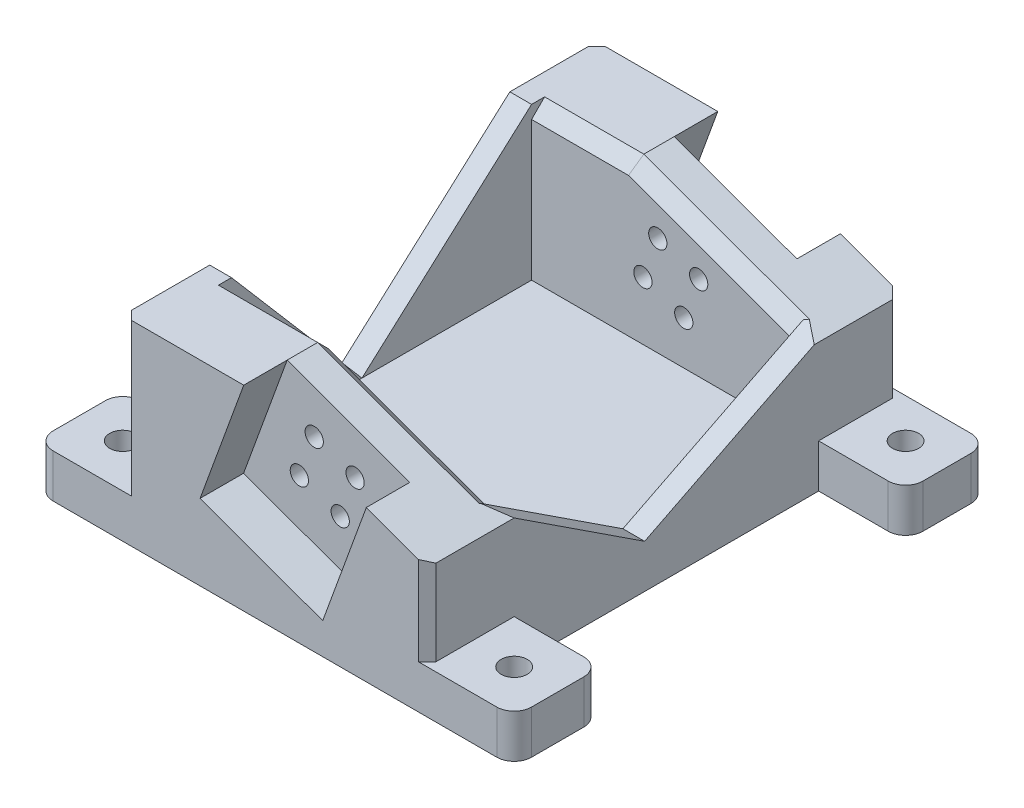
from build123d import *

# Parameters (mm, degrees)
EXTRUDE_1_DEPTH          = 35
EXTRUDE_1_2_DEPTH        = 35
CUT_EXTRUDE_1_DEPTH      = 104.662915259
CUT_EXTRUDE_1_DEPTH_BACK = 104.662915259
SKETCH_2_R               = 2.1
SKETCH_3_W               = 70
SKETCH_3_H               = 10
EXTRUDE_2_DEPTH          = 89
EXTRUDE_3_DEPTH          = 10
EXTRUDE_4_DEPTH          = 10
SKETCH_8_W               = 20
SKETCH_8_H               = 19
SKETCH_8_R               = 3
SKETCH_8_H_2             = 20
EXTRUDE_9_DEPTH          = 10
EXTRUDE_10_DEPTH         = 5
CUT_EXTRUDE_2_DEPTH      = 130.251692445
CUT_EXTRUDE_2_DEPTH_BACK = 130.251692445
EXTRUDE_12_DEPTH         = 5
FILLET_1_R               = 4
FILLET_2_R               = 4
CHAMFER_3_SIZE           = 3
CHAMFER_4_SIZE           = 2


with BuildPart() as part:
    # Эскиз1 → Бобышка-Вытянуть1 (new body)
    with BuildSketch(Plane(origin=(0, 0, 0), x_dir=(1, 0, 0), z_dir=(0, 1, 0))):
        Polygon((0, -40), (30, -40), (30, -30), (-40, -30), (-40, -40), align=None)
    extrude(amount=EXTRUDE_1_DEPTH)


with BuildPart() as body_2:
    # Эскиз1 → Extrude 1 2 (new body)
    with BuildSketch(Plane(origin=(0, 0, 0), x_dir=(1, 0, 0), z_dir=(0, 1, 0))):
        Polygon((0, 49), (30, 49), (30, 39), (-40, 39), (-40, 49), align=None)
    extrude(amount=EXTRUDE_1_2_DEPTH)


with BuildPart() as cut_extrude_1_tool:
    # Эскиз2 → Вырез-Вытянуть1 (new, two sides: drawn at the far end of the back side and taken through both)
    with BuildSketch(Plane.XY.offset(40).offset(-CUT_EXTRUDE_1_DEPTH_BACK)):
        with Locations((0, 10)):
            Circle(SKETCH_2_R)
        with Locations((-9.396926208, 13.420201433)):
            Circle(SKETCH_2_R)
        with Locations((3.420201433, 19.396926208)):
            Circle(SKETCH_2_R)
        with Locations((-5.976724775, 22.817127641)):
            Circle(SKETCH_2_R)
    extrude(amount=CUT_EXTRUDE_1_DEPTH + CUT_EXTRUDE_1_DEPTH_BACK)


with BuildPart() as part_1:
    add(part.part)

    # Вырез-Вытянуть1: cut by cut_extrude_1_tool
    add(cut_extrude_1_tool.part, mode=Mode.SUBTRACT)



with BuildPart() as body_2_1:
    add(body_2.part)

    # Вырез-Вытянуть1: cut by cut_extrude_1_tool
    add(cut_extrude_1_tool.part, mode=Mode.SUBTRACT)


with BuildPart() as part_2:
    add(part_1.part)

    add(body_2_1.part)  # Бобышка-Вытянуть2 merges body 2
    # Эскиз3 → Бобышка-Вытянуть2 (add)
    with BuildSketch(Plane.XY.offset(40)):
        with Locations((-5, -5)):
            Rectangle(SKETCH_3_W, SKETCH_3_H)
    extrude(amount=-EXTRUDE_2_DEPTH)

    # Эскиз4 → Бобышка-Вытянуть3 (add)
    with BuildSketch(Plane.XY.offset(40)):
        Polygon((5.976724775, -2.817127641), (-22.214053849, 7.443476659), (-12.184299593, 35), (-40, 35), (-40, -10), (30, -10), (30, 35), (19.741033581, 35), align=None)
    extrude(amount=EXTRUDE_3_DEPTH)

    # Эскиз5 → Бобышка-Вытянуть4 (add)
    with BuildSketch(Plane(origin=(0, 0, -49), x_dir=(-1, 0, 0), z_dir=(0, 0, -1))):
        Polygon((-30, 35), (-30, -10), (40, -10), (40, 35), (12.184299593, 35), (22.214053849, 7.443476659), (-5.976724775, -2.817127641), (-19.741033581, 35), align=None)
    extrude(amount=EXTRUDE_4_DEPTH)

    # Эскиз8 → Бобышка-Вытянуть9 (add)
    # profile 1 of 4: a face of its own
    with BuildSketch(Plane(origin=(0, -10, 0), x_dir=(-1, 0, 0), z_dir=(0, -1, 0))):
        with Locations((-40, 49.5)):
            Rectangle(SKETCH_8_W, SKETCH_8_H)
        with Locations(Location((-40, 50, 0), (0, 0, 90))):
            Circle(SKETCH_8_R, mode=Mode.SUBTRACT)
    # profile 2 of 4: a face of its own
    with BuildSketch(Plane(origin=(0, -10, 0), x_dir=(-1, 0, 0), z_dir=(0, -1, 0))):
        with Locations((-40, -40)):
            Rectangle(SKETCH_8_W, SKETCH_8_H_2)
        with Locations(Location((-40, -40, 0), (0, 0, 90))):
            Circle(SKETCH_8_R, mode=Mode.SUBTRACT)
    # profile 3 of 4: a face of its own
    with BuildSketch(Plane(origin=(0, -10, 0), x_dir=(-1, 0, 0), z_dir=(0, -1, 0))):
        with Locations((50, 49.5)):
            Rectangle(SKETCH_8_W, SKETCH_8_H)
        with Locations(Location((50, 50, 0), (0, 0, 90))):
            Circle(SKETCH_8_R, mode=Mode.SUBTRACT)
    # profile 4 of 4: a face of its own
    with BuildSketch(Plane(origin=(0, -10, 0), x_dir=(-1, 0, 0), z_dir=(0, -1, 0))):
        with Locations((50, -40)):
            Rectangle(SKETCH_8_W, SKETCH_8_H_2)
        with Locations(Location((50, -40, 0), (0, 0, 90))):
            Circle(SKETCH_8_R, mode=Mode.SUBTRACT)
    extrude(amount=-EXTRUDE_9_DEPTH)

    # Эскиз6 → Бобышка-Вытянуть10 (add)
    with BuildSketch(Plane.ZY.offset(40)):
        Polygon((-39, 0), (0, 0), (-39, 35), align=None)
        Polygon((30, 0), (30, 35), (0, 0), align=None)
    extrude(amount=-EXTRUDE_10_DEPTH)

    # Эскиз10 → Вырез-Вытянуть2 (cut, two sides: drawn at the far end of the back side and taken through both)
    with BuildSketch(Plane.XY.offset(50).offset(-CUT_EXTRUDE_2_DEPTH_BACK)):
        Polygon((30, 19.646170595), (-12.184299593, 35), (30, 35), align=None)
    extrude(amount=CUT_EXTRUDE_2_DEPTH + CUT_EXTRUDE_2_DEPTH_BACK, mode=Mode.SUBTRACT)

    # Эскиз9 → Бобышка-Вытянуть12 (add)
    with BuildSketch(Plane(origin=(30, 0, 0), x_dir=(0, 0, -1), z_dir=(1, 0, 0))):
        Polygon((39, 19.646170595), (39, 0), (0, 0), align=None)
        Polygon((0, 0), (-30, 19.646170595), (-30, 0), align=None)
    extrude(amount=-EXTRUDE_12_DEPTH)

    # Скругление1
    fillet_1_edges = [part_2.edges().sort_by_distance(p)[0] for p in [
        (50, -5, -59),
        (50, -5, 50),
        (-60, -5, -59),
        (-60, -5, 50),
    ]]
    fillet(fillet_1_edges, radius=FILLET_1_R)

    # Скругление2
    fillet_2_edges = [part_2.edges().sort_by_distance(p)[0] for p in [
        (50, -5, -40),
        (50, -5, 30),
        (-60, -5, -40),
        (-60, -5, 30),
    ]]
    fillet(fillet_2_edges, radius=FILLET_2_R)

    # Фаска3
    # the kernel refuses this chamfer: 3 mm, written as the material it takes off along each edge
    with BuildSketch(Plane(origin=(-4.469250629, 35, -39), x_dir=(0, 0.027495876610586768, -0.9996219169112968), z_dir=(-1, 0, 0))) as chamfer_3_piece_1:
        Polygon((CHAMFER_3_SIZE * 0.999621916911, CHAMFER_3_SIZE * 0.0274958766106), (-CHAMFER_3_SIZE * 0.0274958766106, CHAMFER_3_SIZE * 0.999621916911), (0, 0), align=None)
    extrude(amount=30.530749371, mode=Mode.SUBTRACT)
    with BuildSketch(Plane(origin=(-19.434074173, 37.638702152, -39), x_dir=(0.009404143659217951, 0.02583767235300856, -0.9996219169112968), z_dir=(0.9396926207859079, -0.34202014332567027, 0))) as chamfer_3_piece_2_section:
        Polygon((CHAMFER_3_SIZE * 0.999621916911, -CHAMFER_3_SIZE * 0.0274958766106), (-CHAMFER_3_SIZE * 0.0274958766106, -CHAMFER_3_SIZE * 0.999621916911), (0, 0), align=None)
    chamfer_3_piece_2 = extrude(amount=60.321691902, mode=Mode.PRIVATE)
    chamfer_3_piece_2 = split(chamfer_3_piece_2, bisect_by=Plane(origin=(25, 27.771188546, -39.985901666), z_dir=(-1, 0, 0)), keep=Keep.TOP, mode=Mode.PRIVATE)
    add(chamfer_3_piece_2, mode=Mode.SUBTRACT)
    with BuildSketch(Plane(origin=(-19.434074173, 37.638702152, -39), x_dir=(0.009404143659217951, 0.02583767235300856, -0.9996219169112968), z_dir=(0.9396926207859079, -0.34202014332567027, 0))) as chamfer_3_piece_3_section:
        Polygon((CHAMFER_3_SIZE * 0.999621916911, -CHAMFER_3_SIZE * 0.0274958766106), (-CHAMFER_3_SIZE * 0.0274958766106, -CHAMFER_3_SIZE * 0.999621916911), (0, 0), align=None)
    chamfer_3_piece_3 = extrude(amount=60.321691902, mode=Mode.PRIVATE)
    chamfer_3_piece_3 = split(chamfer_3_piece_3, bisect_by=Plane(origin=(26.25970181, 20.183987428, -40.067630782), z_dir=(0, 0.8930842834154016, 0.4498893894241103)), keep=Keep.TOP, mode=Mode.PRIVATE)
    add(chamfer_3_piece_3, mode=Mode.SUBTRACT)
    with BuildSketch(Plane(origin=(-4.469250629, 35, 30), x_dir=(0, 0.027495876610586768, 0.9996219169112968), z_dir=(-1, 0, 0))) as chamfer_3_piece_4:
        Polygon((CHAMFER_3_SIZE * 0.999621916911, -CHAMFER_3_SIZE * 0.0274958766106), (-CHAMFER_3_SIZE * 0.0274958766106, -CHAMFER_3_SIZE * 0.999621916911), (0, 0), align=None)
    extrude(amount=30.530749371, mode=Mode.SUBTRACT)
    with BuildSketch(Plane(origin=(-19.434074173, 37.638702152, 30), x_dir=(0.009404143659217682, 0.025837672353007816, 0.9996219169112968), z_dir=(0.9396926207859079, -0.34202014332567027, 0))) as chamfer_3_piece_5_section:
        Polygon((CHAMFER_3_SIZE * 0.999621916911, CHAMFER_3_SIZE * 0.0274958766106), (-CHAMFER_3_SIZE * 0.0274958766106, CHAMFER_3_SIZE * 0.999621916911), (0, 0), align=None)
    chamfer_3_piece_5 = extrude(amount=60.321691902, mode=Mode.PRIVATE)
    chamfer_3_piece_5 = split(chamfer_3_piece_5, bisect_by=Plane(origin=(25, 27.800984408, 30.984043991), z_dir=(-1, 0, 0)), keep=Keep.TOP, mode=Mode.PRIVATE)
    add(chamfer_3_piece_5, mode=Mode.SUBTRACT)
    with BuildSketch(Plane(origin=(-19.434074173, 37.638702152, 30), x_dir=(0.009404143659217682, 0.025837672353007816, 0.9996219169112968), z_dir=(0.9396926207859079, -0.34202014332567027, 0))) as chamfer_3_piece_6_section:
        Polygon((CHAMFER_3_SIZE * 0.999621916911, CHAMFER_3_SIZE * 0.0274958766106), (-CHAMFER_3_SIZE * 0.0274958766106, CHAMFER_3_SIZE * 0.999621916911), (0, 0), align=None)
    chamfer_3_piece_6 = extrude(amount=60.321691902, mode=Mode.PRIVATE)
    chamfer_3_piece_6 = split(chamfer_3_piece_6, bisect_by=Plane(origin=(26.25, 20.237686054, 30.903253063), z_dir=(0, 0.8365761810170901, -0.547850612261099)), keep=Keep.TOP, mode=Mode.PRIVATE)
    add(chamfer_3_piece_6, mode=Mode.SUBTRACT)

    # Фаска4
    chamfer_4_edges = [part_2.edges().sort_by_distance(p)[0] for p in [
        (30, 9.823085297, 50),
        (-40, 17.5, -59),
        (30, 9.823085297, -59),
        (-40, 17.5, 50),
    ]]
    chamfer(chamfer_4_edges, length=CHAMFER_4_SIZE)


solid = part_2.part
